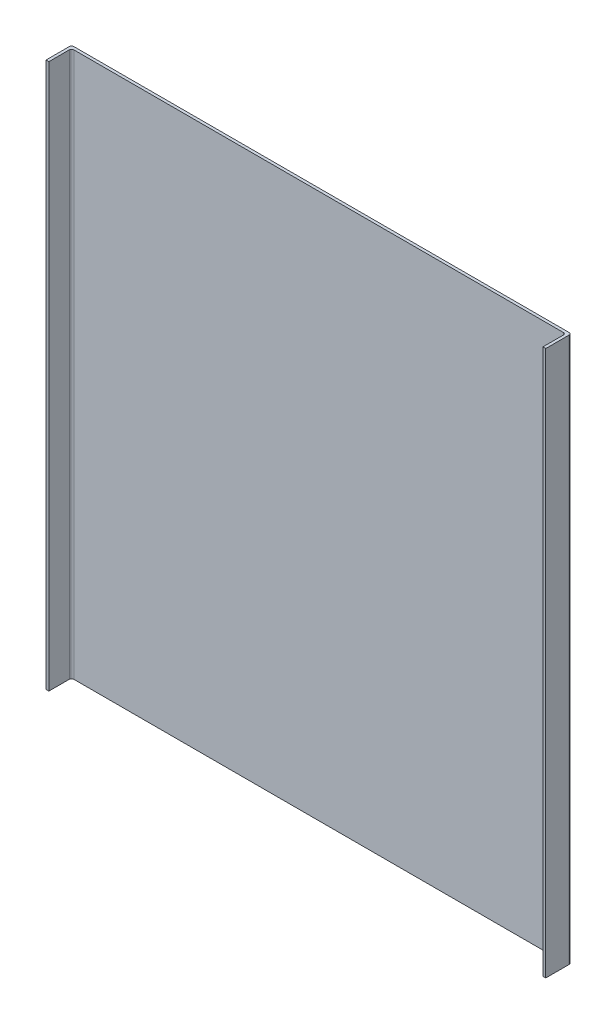
from build123d import *

# Parameters (mm, degrees)
SKETCH1_W           = 1117.6
SKETCH1_H           = 1219.2
BOSS_EXTRUDE1_DEPTH = 6.35
SKETCH2_W           = 6.35
SKETCH2_H           = 1219.2
BOSS_EXTRUDE2_DEPTH = 50.8
FILLET1_R           = 5


with BuildPart() as part:
    # Sketch1 → Boss-Extrude1 (new body)
    with BuildSketch(Plane.XY):
        with Locations((558.8, 609.6)):
            Rectangle(SKETCH1_W, SKETCH1_H)
    extrude(amount=BOSS_EXTRUDE1_DEPTH)

    # Sketch2 → Boss-Extrude2 (add)
    with BuildSketch(Plane.XY.offset(6.35)):
        with Locations((3.175, 609.6)):
            Rectangle(SKETCH2_W, SKETCH2_H)
        with Locations((1114.425, 609.6)):
            Rectangle(SKETCH2_W, SKETCH2_H)
    extrude(amount=BOSS_EXTRUDE2_DEPTH)

    # Fillet1
    fillet1_edges = [part.edges().sort_by_distance(p)[0] for p in [
        (1117.6, 609.6, 0),
        (0, 609.6, 0),
        (1111.25, 609.6, 6.35),
        (6.35, 609.6, 6.35),
    ]]
    fillet(fillet1_edges, radius=FILLET1_R)


solid = part.part
